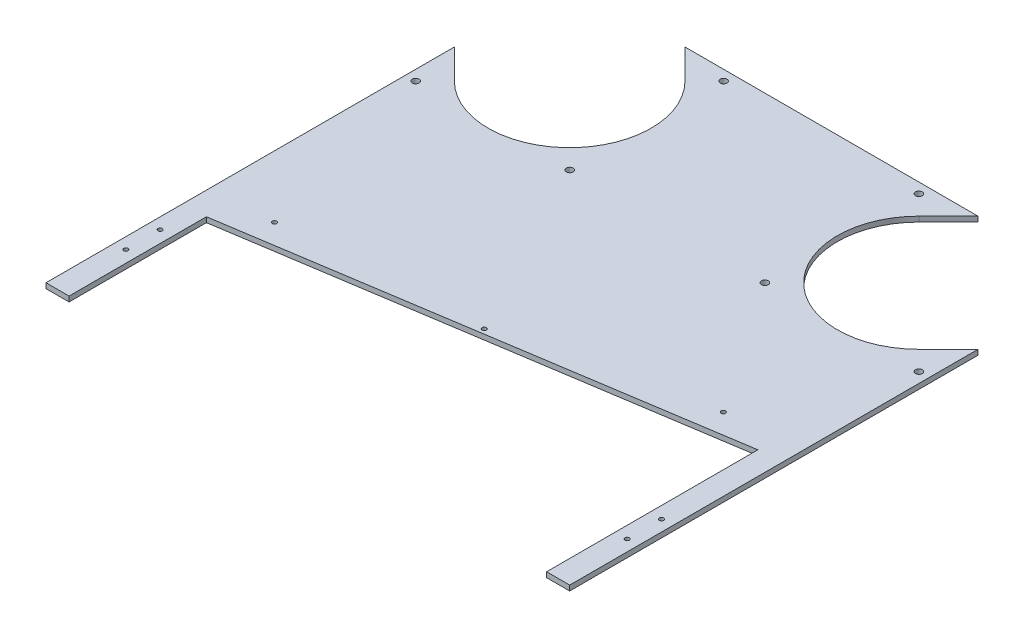
from build123d import *

# Parameters (mm, degrees)
BASE_FLANGE1_DEPTH    = 3
M3_TAPPED_HOLE1_D     = 2.5
M3_TAPPED_HOLE1_DEPTH = 7.5
M3_TAPPED_HOLE1_TIP   = 0.751075774
M3_TAPPED_HOLE2_D     = 2.5
M3_TAPPED_HOLE2_DEPTH = 7.5
M3_TAPPED_HOLE2_TIP   = 0.751075774
SKETCH11_R            = 47.5
SKETCH11_R_2          = 1.984375
CUT_EXTRUDE1_DEPTH    = 365.73826232


# Sheet-metal steps are written as plain solids
with BuildPart() as part:
    # Sketch1 → Base-Flange1 (new body)
    with BuildSketch(Plane(origin=(0, 0, 0), x_dir=(1, 0, 0), z_dir=(0, 1, 0))):
        Polygon((0, 0), (0, 200), (305, 200), (305, 35.309832976), (305, -105), (291.57115, -105), (291.57115, 18.045832093), (13.42885, -25), (13.42885, -105), (0, -105), align=None)
    extrude(amount=-BASE_FLANGE1_DEPTH)

    # M3 Tapped Hole1
    with Locations(Plane(origin=(0, 0, 0), x_dir=(1, 0, 0), z_dir=(0, 1, 0))):
        with Locations((6.5, -45), (6.5, -65), (298.5, -45), (298.5, -65)):
            Hole(M3_TAPPED_HOLE1_D / 2, depth=M3_TAPPED_HOLE1_DEPTH)
            with Locations((0, 0, -(M3_TAPPED_HOLE1_DEPTH + M3_TAPPED_HOLE1_TIP / 2))):  # 118° drill point
                Cone(0, M3_TAPPED_HOLE1_D / 2, M3_TAPPED_HOLE1_TIP, mode=Mode.SUBTRACT)

    # M3 Tapped Hole2
    with Locations(Plane(origin=(0, 0, 0), x_dir=(1, 0, 0), z_dir=(0, 1, 0))):
        with Locations((36.116318069, -8.031256885), (150.87789947, -0.629943868), (262.508000343, 27.005551046)):
            Hole(M3_TAPPED_HOLE2_D / 2, depth=M3_TAPPED_HOLE2_DEPTH)
            with Locations((0, 0, -(M3_TAPPED_HOLE2_DEPTH + M3_TAPPED_HOLE2_TIP / 2))):  # 118° drill point
                Cone(0, M3_TAPPED_HOLE2_D / 2, M3_TAPPED_HOLE2_TIP, mode=Mode.SUBTRACT)

    # Sketch11 → Cut-Extrude1 (cut, through all)
    with BuildSketch(Plane(origin=(0, 0, 0), x_dir=(1, 0, 0), z_dir=(0, 1, 0))):
        with BuildLine():
            Line((0, 200), (0, 132.824855788))
            Line((0, 132.824855788), (17.212427894, 115.612427894))
            ThreePointArc((17.212427894, 115.612427894), (17.212427894, 182.787572107), (84.387572107, 182.787572107))
            Line((84.387572107, 182.787572107), (67.175144213, 200))
            Line((67.175144213, 200), (0, 200))
        make_face()
        with Locations((50.8, 149.2)):
            Circle(SKETCH11_R)
        with Locations((254.2, 149.2)):
            Circle(SKETCH11_R)
        with BuildLine():
            Line((305, 200), (237.824855787, 200))
            Line((237.824855787, 200), (220.612427894, 182.787572106))
            ThreePointArc((220.612427894, 182.787572106), (272.377463037, 193.084277794), (301.7, 149.2))
            ThreePointArc((301.7, 149.2), (298.084277794, 131.022536963), (287.787572106, 115.612427894))
            Line((287.787572106, 115.612427894), (305, 132.824855787))
            Line((305, 132.824855787), (305, 200))
        make_face()
        with Locations(Location((95.6437, 194.0437, 0), (0, 0, 270))):
            Circle(SKETCH11_R_2)
        with Locations(Location((5.9563, 104.3563, 0), (0, 0, 270))):
            Circle(SKETCH11_R_2)
        with Locations(Location((95.6437, 104.3563, 0), (0, 0, 270))):
            Circle(SKETCH11_R_2)
        with Locations(Location((209.3563, 194.0437, 0), (0, 0, 270))):
            Circle(SKETCH11_R_2)
        with Locations(Location((209.3563, 104.3563, 0), (0, 0, 270))):
            Circle(SKETCH11_R_2)
        with Locations(Location((299.0437, 104.3563, 0), (0, 0, 270))):
            Circle(SKETCH11_R_2)
    extrude(amount=-CUT_EXTRUDE1_DEPTH, mode=Mode.SUBTRACT)


solid = part.part
